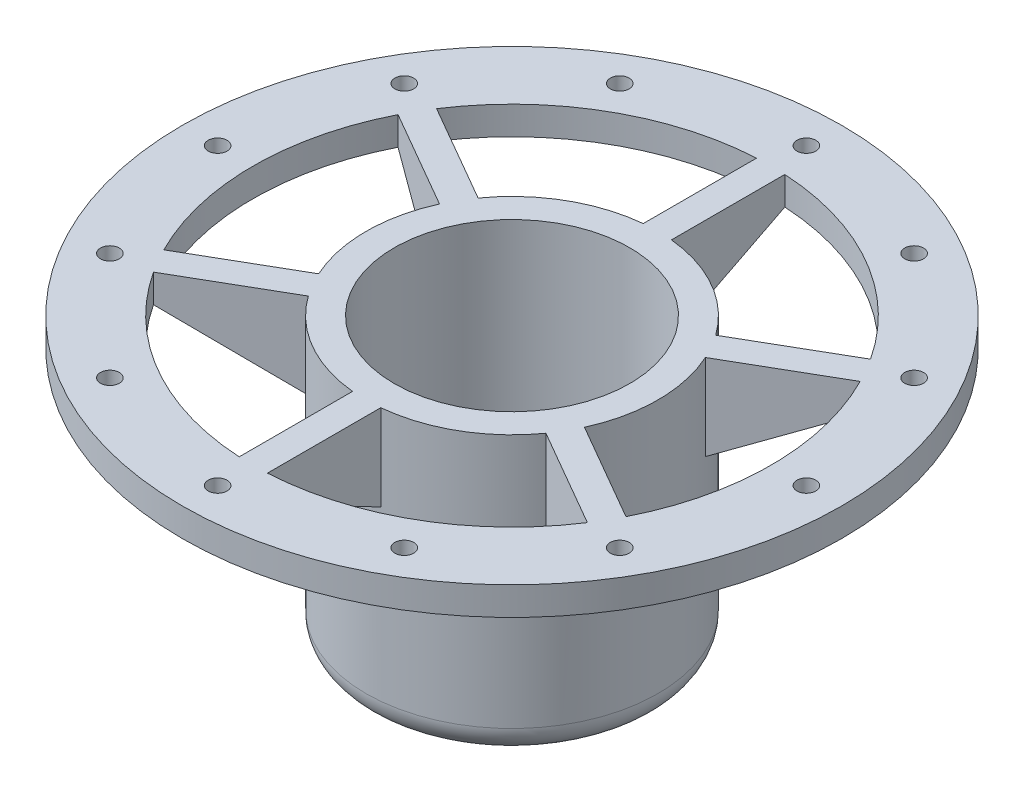
from build123d import *
from OCP.BRepFilletAPI import BRepFilletAPI_MakeChamfer

# Parameters (mm, degrees)
SKETCH2_R           = 31
SKETCH2_R_2         = 25
SKETCH2_R_3         = 4
SKETCH2_R_4         = 3
SKETCH2_R_5         = 3.333333333
BOSS_EXTRUDE1_DEPTH = 10
BOSS_EXTRUDE2_START = 50
SKETCH2_3_R         = 31
SKETCH2_3_R_2       = 25
BOSS_EXTRUDE2_DEPTH = 50
FILLET1_R           = 6
SKETCH3_R           = 7
CUT_EXTRUDE1_DEPTH  = 3
BOSS_EXTRUDE3_DEPTH = 6
CIRPATTERN1_COUNT   = 6
BOSS_EXTRUDE4_START = 44
SKETCH6_R           = 70
SKETCH6_R_2         = 55
BOSS_EXTRUDE4_DEPTH = 6
CHAMFER1_SIZE       = 12.228610788
CHAMFER1_SIZE_2     = 24
CUT_EXTRUDE2_DEPTH  = 6
CIRPATTERN2_COUNT   = 12


with BuildPart() as part:
    # Sketch2 → Boss-Extrude1 (new body)
    # profile 1 of 2: a face of its own
    with BuildSketch(Plane(origin=(0, 0, 0), x_dir=(1, 0, 0), z_dir=(0, 1, 0))):
        with Locations(Location((0, 0, 0), (0, 0, 270))):
            Circle(SKETCH2_R)
        Circle(SKETCH2_R_2, mode=Mode.SUBTRACT)
    # profile 2 of 2: a face of its own
    with BuildSketch(Plane(origin=(0, 0, 0), x_dir=(1, 0, 0), z_dir=(0, 1, 0))):
        Circle(SKETCH2_R_2)
        with Locations(Location((0, 0, 0), (0, 0, 270))):
            Circle(SKETCH2_R_3, mode=Mode.SUBTRACT)
        with Locations(Location((-16, 0, 0), (0, 0, 270))):
            Circle(SKETCH2_R_4, mode=Mode.SUBTRACT)
        with Locations(Location((16, 0, 0), (0, 0, 270))):
            Circle(SKETCH2_R_5, mode=Mode.SUBTRACT)
    extrude(amount=-BOSS_EXTRUDE1_DEPTH)

    # Sketch2<3> → Boss-Extrude2 (add)
    with BuildSketch(Plane(origin=(0, 0, 0), x_dir=(1, 0, 0), z_dir=(0, 1, 0)).offset(BOSS_EXTRUDE2_START)):
        with Locations(Location((0, 0, 0), (0, 0, 270))):
            Circle(SKETCH2_3_R)
        with Locations(Location((0, 0, 0), (0, 0, 270))):
            Circle(SKETCH2_3_R_2, mode=Mode.SUBTRACT)
    extrude(amount=-BOSS_EXTRUDE2_DEPTH)

    # Fillet1
    fillet1_edges = [part.edges().sort_by_distance(p)[0] for p in [
        (0, -10, -31),
    ]]
    fillet(fillet1_edges, radius=FILLET1_R)

    # Sketch3 → Cut-Extrude1 (cut)
    with BuildSketch(Plane.XZ.offset(10)):
        with Locations(Location((16, 0, 0), (0, 0, 270))):
            Circle(SKETCH3_R)
        with Locations(Location((-16, 0, 0), (0, 0, 270))):
            Circle(SKETCH3_R)
    extrude(amount=-CUT_EXTRUDE1_DEPTH, mode=Mode.SUBTRACT)

    # Sketch4 → Boss-Extrude3 (add)
    with BuildSketch(Plane(origin=(0, 50, 0), x_dir=(1, 0, 0), z_dir=(0, 1, 0))):
        with BuildLine():
            ThreePointArc((0, 31), (1.500563555, 30.963661105), (2.997609122, 30.854729614))
            Line((2.997609122, 30.854729614), (2.997609122, 54.918251425))
            ThreePointArc((2.997609122, 54.918251425), (1.499361804, 54.979559058), (0, 55))
            Line((0, 55), (0, 31))
        make_face()
        with BuildLine():
            ThreePointArc((-2.997609122, 30.854729614), (-1.500563555, 30.963661105), (0, 31))
            Line((0, 31), (0, 55))
            ThreePointArc((0, 55), (-1.499361804, 54.979559058), (-2.997609122, 54.918251425))
            Line((-2.997609122, 54.918251425), (-2.997609122, 30.854729614))
        make_face()
    boss_extrude3 = extrude(amount=-BOSS_EXTRUDE3_DEPTH)

    # CirPattern1: Boss-Extrude3 ×6 about axis
    cirpattern1_axis = Axis((0, 0, 0), (0, 1, 0))
    for i in range(1, CIRPATTERN1_COUNT):
        add(boss_extrude3.rotate(cirpattern1_axis, i * 360 / CIRPATTERN1_COUNT))

    # Sketch6 → Boss-Extrude4 (add)
    with BuildSketch(Plane(origin=(0, 0, 0), x_dir=(1, 0, 0), z_dir=(0, 1, 0)).offset(BOSS_EXTRUDE4_START)):
        with Locations(Location((0, 0, 0), (0, 0, 270))):
            Circle(SKETCH6_R)
        Circle(SKETCH6_R_2, mode=Mode.SUBTRACT)
    extrude(amount=BOSS_EXTRUDE4_DEPTH)

    # Chamfer1
    chamfer1_edges_1 = [part.edges().sort_by_distance(p)[0] for p in [
        (0, 44, -31),
    ]]
    chamfer1_side_1 = [part.faces().sort_by_distance(p)[0] for p in [
        (0, 43.755427784, -31),
    ]]
    chamfer1_edges_2 = [part.edges().sort_by_distance(p)[0] for p in [
        (-26.846787517, 44, 15.5),
    ]]
    chamfer1_side_2 = [part.faces().sort_by_distance(p)[0] for p in [
        (-26.846787517, 43.755427784, 15.5),
    ]]
    chamfer1_edges_3 = [part.edges().sort_by_distance(p)[0] for p in [
        (-26.846787517, 44, -15.5),
    ]]
    chamfer1_side_3 = [part.faces().sort_by_distance(p)[0] for p in [
        (-26.846787517, 43.755427784, -15.5),
    ]]
    chamfer1_edges_4 = [part.edges().sort_by_distance(p)[0] for p in [
        (26.846787517, 44, -15.5),
    ]]
    chamfer1_side_4 = [part.faces().sort_by_distance(p)[0] for p in [
        (26.846787517, 43.755427784, -15.5),
    ]]
    chamfer1_edges_5 = [part.edges().sort_by_distance(p)[0] for p in [
        (26.846787517, 44, 15.5),
    ]]
    chamfer1_side_5 = [part.faces().sort_by_distance(p)[0] for p in [
        (26.846787517, 43.755427784, 15.5),
    ]]
    chamfer1_edges_6 = [part.edges().sort_by_distance(p)[0] for p in [
        (1.500563555, 44, 30.963661105),
    ]]
    chamfer1_side_6 = [part.faces().sort_by_distance(p)[0] for p in [
        (1.500563555, 43.755427784, 30.963661105),
    ]]
    chamfer1 = BRepFilletAPI_MakeChamfer(part.part.solid().wrapped)
    for e in chamfer1_edges_1:
        chamfer1.Add(CHAMFER1_SIZE - 0.0001, CHAMFER1_SIZE_2 - 0.0001, e.wrapped, chamfer1_side_1[0].wrapped)
    for e in chamfer1_edges_2:
        chamfer1.Add(CHAMFER1_SIZE - 0.0001, CHAMFER1_SIZE_2 - 0.0001, e.wrapped, chamfer1_side_2[0].wrapped)
    for e in chamfer1_edges_3:
        chamfer1.Add(CHAMFER1_SIZE - 0.0001, CHAMFER1_SIZE_2 - 0.0001, e.wrapped, chamfer1_side_3[0].wrapped)
    for e in chamfer1_edges_4:
        chamfer1.Add(CHAMFER1_SIZE - 0.0001, CHAMFER1_SIZE_2 - 0.0001, e.wrapped, chamfer1_side_4[0].wrapped)
    for e in chamfer1_edges_5:
        chamfer1.Add(CHAMFER1_SIZE - 0.0001, CHAMFER1_SIZE_2 - 0.0001, e.wrapped, chamfer1_side_5[0].wrapped)
    for e in chamfer1_edges_6:
        chamfer1.Add(CHAMFER1_SIZE - 0.0001, CHAMFER1_SIZE_2 - 0.0001, e.wrapped, chamfer1_side_6[0].wrapped)
    add(Compound.cast(chamfer1.Shape()), mode=Mode.REPLACE)  # a hair under: the kernel refuses the full size

    # Sketch7 → Cut-Extrude2 (cut)
    with BuildSketch(Plane(origin=(0, 50, 0), x_dir=(1, 0, 0), z_dir=(0, 1, 0))):
        with BuildLine():
            ThreePointArc((0, -60.5), (-2, -62.5), (0, -64.5))
            Line((0, -64.5), (0, -60.5))
        make_face()
        with BuildLine():
            Line((0, -60.5), (0, -64.5))
            ThreePointArc((0, -64.5), (1.414213562, -63.914213562), (2, -62.5))
            ThreePointArc((2, -62.5), (1.414213562, -61.085786438), (0, -60.5))
        make_face()
    cut_extrude2 = extrude(amount=-CUT_EXTRUDE2_DEPTH, mode=Mode.SUBTRACT)

    # CirPattern2: Cut-Extrude2 ×12 about axis
    cirpattern2_axis = Axis((0, 0, 0), (0, 1, 0))
    for i in range(1, CIRPATTERN2_COUNT):
        add(cut_extrude2.rotate(cirpattern2_axis, i * 360 / CIRPATTERN2_COUNT), mode=Mode.SUBTRACT)


solid = part.part
